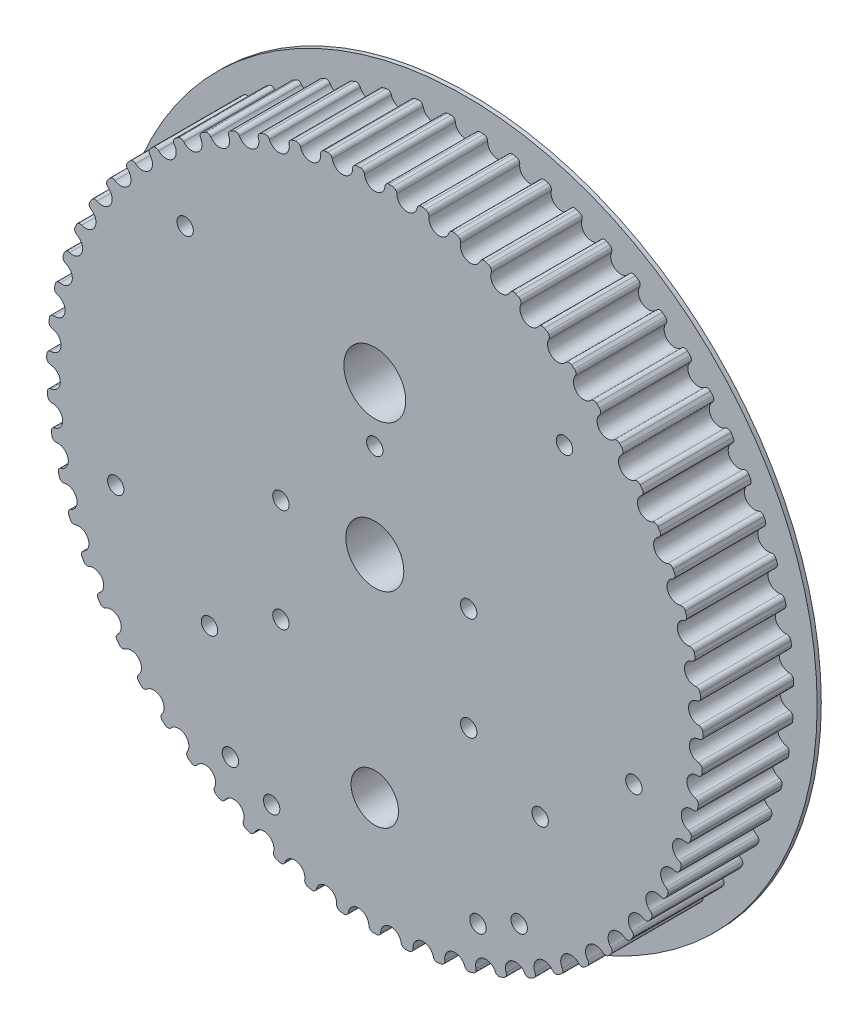
from build123d import *

# Parameters (mm, degrees)
BOSS_EXTRUDE1_DEPTH = 22
SKETCH2_R           = 85.214091318
BOSS_EXTRUDE2_DEPTH = 1
SKETCH3_R           = 7.025
SKETCH3_R_2         = 5.75
SKETCH3_R_3         = 7.5
CUT_EXTRUDE1_DEPTH  = 123.686114611
SKETCH4_R           = 1.985
CUT_EXTRUDE2_DEPTH  = 18


with BuildPart() as part:
    # Sketch1 → Boss-Extrude1 (new body)
    with BuildSketch(Plane.XY):
        with BuildLine():
            ThreePointArc((2.481562541, 78.535189471), (0, 76.25), (-2.481562541, 78.535189471))
            ThreePointArc((-2.481562541, 78.535189471), (-2.817232799, 79.203373934), (-3.522465026, 79.451954917))
            ThreePointArc((-3.522465026, 79.451954917), (-3.743368627, 79.441853524), (-3.964243287, 79.431137945))
            ThreePointArc((-3.964243287, 79.431137945), (-4.185087298, 79.419808262), (-4.405898952, 79.407864563))
            ThreePointArc((-4.405898952, 79.407864563), (-5.082876049, 79.09030038), (-5.350348598, 78.392014311))
            ThreePointArc((-5.350348598, 78.392014311), (-7.592048303, 75.871096622), (-10.288810797, 77.897846634))
            ThreePointArc((-10.288810797, 77.897846634), (-10.689342722, 78.529288774), (-11.415821165, 78.706416048))
            ThreePointArc((-11.415821165, 78.706416048), (-11.634621272, 78.674369955), (-11.853331429, 78.64171561))
            ThreePointArc((-11.853331429, 78.64171561), (-12.071949944, 78.608453264), (-12.290475128, 78.574583175))
            ThreePointArc((-12.290475128, 78.574583175), (-12.932468992, 78.191191889), (-13.129085569, 77.469744094))
            ThreePointArc((-13.129085569, 77.469744094), (-15.108643419, 74.738152198), (-17.993804229, 76.48632))
            ThreePointArc((-17.993804229, 76.48632), (-18.455217155, 77.074744261), (-19.195721745, 77.178657456))
            ThreePointArc((-19.195721745, 77.178657456), (-19.410243824, 77.124985152), (-19.624615838, 77.070716574))
            ThreePointArc((-19.624615838, 77.070716574), (-19.838836129, 77.015852141), (-20.05290304, 76.960392278))
            ThreePointArc((-20.05290304, 76.960392278), (-20.653533247, 76.514984203), (-20.777339789, 75.777544755))
            ThreePointArc((-20.777339789, 75.777544755), (-22.475082049, 72.862426441), (-25.51996715, 74.314637956))
            ThreePointArc((-25.51996715, 74.314637956), (-26.037675348, 74.854196313), (-26.784846617, 74.883862692))
            ThreePointArc((-26.784846617, 74.883862692), (-26.992958653, 74.809097596), (-27.200861999, 74.733754131))
            ThreePointArc((-27.200861999, 74.733754131), (-27.408555047, 74.657832879), (-27.616036193, 74.581334428))
            ThreePointArc((-27.616036193, 74.581334428), (-28.169333411, 74.078336229), (-28.219099472, 73.332234132))
            ThreePointArc((-28.219099472, 73.332234132), (-29.618153216, 70.262561155), (-32.792501173, 71.404383652))
            ThreePointArc((-32.792501173, 71.404383652), (-33.361359426, 71.889713732), (-34.107771651, 71.844838458))
            ThreePointArc((-34.107771651, 71.844838458), (-34.307405331, 71.749723619), (-34.506773772, 71.654054064))
            ThreePointArc((-34.506773772, 71.654054064), (-34.705875432, 71.557830533), (-34.904708771, 71.461053768))
            ThreePointArc((-34.904708771, 71.461053768), (-35.405174083, 70.905464468), (-35.380405067, 70.15811482))
            ThreePointArc((-35.380405067, 70.15811482), (-36.46686587, 66.964394969), (-39.739128586, 67.784480503))
            ThreePointArc((-39.739128586, 67.784480503), (-40.353483326, 68.210758878), (-41.091718326, 68.091787941))
            ThreePointArc((-41.091718326, 68.091787941), (-41.280889602, 67.977268654), (-41.469741725, 67.862223816))
            ThreePointArc((-41.469741725, 67.862223816), (-41.658273234, 67.746654317), (-41.846482671, 67.630561051))
            ThreePointArc((-41.846482671, 67.630561051), (-42.289142228, 67.027902345), (-42.1900843, 66.286732644))
            ThreePointArc((-42.1900843, 66.286732644), (-42.953154427, 63.000706542), (-46.290810685, 63.490904734))
            ThreePointArc((-46.290810685, 63.490904734), (-46.944556178, 63.853894857), (-47.667277043, 63.662010644))
            ThreePointArc((-47.667277043, 63.662010644), (-47.844105846, 63.529225053), (-48.020564753, 63.395948299))
            ThreePointArc((-48.020564753, 63.395948299), (-48.1966524, 63.262181415), (-48.372367426, 63.127925434))
            ThreePointArc((-48.372367426, 63.127925434), (-48.752821879, 62.484186815), (-48.580459521, 61.756563138))
            ThreePointArc((-48.580459521, 61.756563138), (-49.012555239, 58.410888788), (-52.382433911, 58.566327829))
            ThreePointArc((-52.382433911, 58.566327829), (-53.069072941, 58.862422142), (-53.769096946, 58.599531685))
            ThreePointArc((-53.769096946, 58.599531685), (-53.931825871, 58.449799471), (-54.094137835, 58.299615367))
            ThreePointArc((-54.094137835, 58.299615367), (-54.256031583, 58.148980532), (-54.417505862, 57.997896132))
            ThreePointArc((-54.417505862, 57.997896132), (-54.731974083, 57.319475365), (-54.488020309, 56.612629161))
            ThreePointArc((-54.488020309, 56.612629161), (-54.584847256, 53.240557379), (-57.953456975, 53.059692446))
            ThreePointArc((-57.953456975, 53.059692446), (-58.666165415, 53.28594823), (-59.336535406, 52.954664252))
            ThreePointArc((-59.336535406, 52.954664252), (-59.483547181, 52.789473523), (-59.630099072, 52.623874664))
            ThreePointArc((-59.630099072, 52.623874664), (-59.776189947, 52.457868956), (-59.921818676, 52.291457682))
            ThreePointArc((-59.921818676, 52.291457682), (-60.16717534, 51.585097217), (-59.854054672, 50.906053443))
            ThreePointArc((-59.854054672, 50.906053443), (-59.614650538, 47.541097392), (-62.948512547, 47.025726001))
            ThreePointArc((-62.948512547, 47.025726001), (-63.680207179, 47.179894625), (-64.314260719, 46.783509575))
            ThreePointArc((-64.314260719, 46.783509575), (-64.444094274, 46.60450207), (-64.573429595, 46.425134253))
            ThreePointArc((-64.573429595, 46.425134253), (-64.70226568, 46.245407511), (-64.830601536, 46.065323233))
            ThreePointArc((-64.830601536, 46.065323233), (-65.004408176, 45.338043196), (-64.625232549, 44.693550494))
            ThreePointArc((-64.625232549, 44.693550494), (-64.05197664, 41.36915262), (-67.31795752, 40.524396765))
            ThreePointArc((-67.31795752, 40.524396765), (-68.061366435, 40.604946031), (-68.652802015, 40.147399361))
            ThreePointArc((-68.652802015, 40.147399361), (-68.764167006, 39.956354137), (-68.875000363, 39.765))
            ThreePointArc((-68.875000363, 39.765), (-68.985301229, 39.573338429), (-69.09506875, 39.381370905))
            ThreePointArc((-69.09506875, 39.381370905), (-69.195598, 38.640399334), (-68.754135831, 38.036862961))
            ThreePointArc((-68.754135831, 38.036862961), (-67.852725422, 34.786062623), (-71.018366388, 33.620317866))
            ThreePointArc((-71.018366388, 33.620317866), (-71.766101254, 33.62644724), (-72.309040921, 33.112286256))
            ThreePointArc((-72.309040921, 33.112286256), (-72.400830553, 32.911102006), (-72.492060434, 32.709663312))
            ThreePointArc((-72.492060434, 32.709663312), (-72.58272986, 32.50797173), (-72.67283813, 32.306028821))
            ThreePointArc((-72.67283813, 32.306028821), (-72.699090883, 31.558729823), (-72.199729622, 31.002147995))
            ThreePointArc((-72.199729622, 31.002147995), (-70.979123334, 27.857253108), (-74.012962824, 26.382105145))
            ThreePointArc((-74.012962824, 26.382105145), (-74.757592316, 26.31375371), (-75.246640092, 25.748088374))
            ThreePointArc((-75.246640092, 25.748088374), (-75.317942118, 25.538764558), (-75.388661841, 25.329243295))
            ThreePointArc((-75.388661841, 25.329243295), (-75.458798713, 25.119526204), (-75.528352194, 24.909614908))
            ThreePointArc((-75.528352194, 24.909614908), (-75.480067539, 24.163415477), (-74.927770063, 23.659319755))
            ThreePointArc((-74.927770063, 23.659319755), (-73.40009883, 20.651585696), (-76.271985184, 18.881695209))
            ThreePointArc((-76.271985184, 18.881695209), (-77.006108839, 18.739542273), (-77.436404347, 18.127994421))
            ThreePointArc((-77.436404347, 18.127994421), (-77.486510136, 17.912611393), (-77.536016856, 17.697089878))
            ThreePointArc((-77.536016856, 17.697089878), (-77.584924124, 17.481431541), (-77.633231562, 17.265638051))
            ThreePointArc((-77.633231562, 17.265638051), (-77.510889373, 16.527954251), (-76.911144662, 16.081354565))
            ThreePointArc((-76.911144662, 16.081354565), (-75.091591167, 13.240673547), (-77.772982288, 11.193630504))
            ThreePointArc((-77.772982288, 11.193630504), (-78.489304057, 10.979088846), (-78.856570827, 10.327736316))
            ThreePointArc((-78.856570827, 10.327736316), (-78.884982404, 10.108434649), (-78.912784101, 9.889054831))
            ThreePointArc((-78.912784101, 9.889054831), (-78.939975701, 9.669598558), (-78.966556996, 9.450067526))
            ThreePointArc((-78.966556996, 9.450067526), (-78.771373166, 8.728230791), (-78.130141751, 8.343565648))
            ThreePointArc((-78.130141751, 8.343565648), (-76.036789535, 5.698169636), (-78.501036553, 3.39431847))
            ThreePointArc((-78.501036553, 3.39431847), (-79.192437307, 3.109520302), (-79.493025278, 2.424836527))
            ThreePointArc((-79.493025278, 2.424836527), (-79.499460277, 2.203795739), (-79.505280645, 1.982737914))
            ThreePointArc((-79.505280645, 1.982737914), (-79.510486335, 1.761664759), (-79.515077309, 1.540577985))
            ThreePointArc((-79.515077309, 1.540577985), (-79.248991662, 0.841762252), (-78.572646391, 0.522854628))
            ThreePointArc((-78.572646391, 0.522854628), (-76.226300128, -1.900965245), (-78.448912249, -4.438727826))
            ThreePointArc((-78.448912249, -4.438727826), (-79.108520537, -4.790952053), (-79.33944233, -5.502162377))
            ThreePointArc((-79.33944233, -5.502162377), (-79.323836797, -5.722745482), (-79.30761799, -5.943284343))
            ThreePointArc((-79.30761799, -5.943284343), (-79.290786034, -6.163777255), (-79.273341061, -6.384222513))
            ThreePointArc((-79.273341061, -6.384222513), (-78.938998076, -7.053072098), (-78.23426077, -7.303052757))
            ThreePointArc((-78.23426077, -7.303052757), (-75.658239503, -9.481207479), (-77.617127411, -12.227660051))
            ThreePointArc((-77.617127411, -12.227660051), (-78.238387749, -12.643809773), (-78.397348359, -13.374478319))
            ThreePointArc((-78.397348359, -13.374478319), (-78.359857389, -13.592411488), (-78.321760597, -13.81023957))
            ThreePointArc((-78.321760597, -13.81023957), (-78.283058279, -14.027960881), (-78.243750734, -14.245573739))
            ThreePointArc((-78.243750734, -14.245573739), (-77.844473261, -14.877809849), (-77.118347918, -15.056379122))
            ThreePointArc((-77.118347918, -15.056379122), (-74.338253304, -16.967221214), (-76.013948689, -19.895068297))
            ThreePointArc((-76.013948689, -19.895068297), (-76.590686714, -20.371007631), (-76.676106319, -21.113872687))
            ThreePointArc((-76.676106319, -21.113872687), (-76.617102513, -21.326990001), (-76.55750636, -21.539942431))
            ThreePointArc((-76.55750636, -21.539942431), (-76.49731832, -21.75272833), (-76.436538859, -21.965346053))
            ThreePointArc((-76.436538859, -21.965346053), (-75.976295098, -22.554685242), (-75.235998277, -22.660068427))
            ThreePointArc((-75.235998277, -22.660068427), (-72.279460145, -24.284607082), (-73.655309194, -27.364750416))
            ThreePointArc((-73.655309194, -27.364750416), (-74.181793024, -27.895749264), (-74.192822685, -28.643427902))
            ThreePointArc((-74.192822685, -28.643427902), (-74.112892451, -28.849611307), (-74.03238923, -29.055571668))
            ThreePointArc((-74.03238923, -29.055571668), (-73.951313644, -29.261307392), (-73.869666321, -29.46681689))
            ThreePointArc((-73.869666321, -29.46681689), (-73.353030381, -30.00740204), (-72.605919484, -30.038551792))
            ThreePointArc((-72.605919484, -30.038551792), (-69.502321239, -31.360641614), (-70.564650146, -34.562469351))
            ThreePointArc((-70.564650146, -34.562469351), (-71.035647347, -35.143250407), (-70.972177448, -35.888311862))
            ThreePointArc((-70.972177448, -35.888311862), (-70.872115167, -36.085512214), (-70.771504955, -36.282433579))
            ThreePointArc((-70.771504955, -36.282433579), (-70.670347589, -36.479074435), (-70.568643852, -36.675433262))
            ThreePointArc((-70.568643852, -36.675433262), (-70.000750292, -37.161891795), (-69.254250443, -37.118498533))
            ThreePointArc((-69.254250443, -37.118498533), (-66.034437039, -38.125), (-66.772687902, -41.416690937))
            ThreePointArc((-66.772687902, -41.416690937), (-67.183517493, -42.04148214), (-67.046178825, -42.776521655))
            ThreePointArc((-67.046178825, -42.776521655), (-66.926978962, -42.962779089), (-66.807261668, -43.148704365))
            ThreePointArc((-66.807261668, -43.148704365), (-66.687027869, -43.334296048), (-66.566278495, -43.519552701))
            ThreePointArc((-66.566278495, -43.519552701), (-65.952771298, -43.947049973), (-65.214301548, -43.82954496))
            ThreePointArc((-65.214301548, -43.82954496), (-61.910272936, -44.510455008), (-62.317108686, -47.859294842))
            ThreePointArc((-62.317108686, -47.859294842), (-62.663687658, -48.521886734), (-62.453845156, -49.239599158))
            ThreePointArc((-62.453845156, -49.239599158), (-62.316692372, -49.413062563), (-62.179057801, -49.586143942))
            ThreePointArc((-62.179057801, -49.586143942), (-62.040942507, -49.758841957), (-61.902347557, -49.931155273))
            ThreePointArc((-61.902347557, -49.931155273), (-61.249324032, -50.295442625), (-60.526223625, -50.104993678))
            ThreePointArc((-60.526223625, -50.104993678), (-57.170816726, -50.453545117), (-57.242194048, -53.826251573))
            ThreePointArc((-57.242194048, -53.826251573), (-57.521077943, -54.520059019), (-57.240817114, -55.213311403))
            ThreePointArc((-57.240817114, -55.213311403), (-57.087074496, -55.372256822), (-56.932890522, -55.530774142))
            ThreePointArc((-56.932890522, -55.530774142), (-56.778266384, -55.68886214), (-56.623203278, -55.846519592))
            ThreePointArc((-56.623203278, -55.846519592), (-55.937153466, -56.143976572), (-55.2366089, -55.882476458))
            ThreePointArc((-55.2366089, -55.882476458), (-51.863171255, -55.895205227), (-51.598380767, -59.258258834))
            ThreePointArc((-51.598380767, -59.258258834), (-51.806797913, -59.976386464), (-51.458904116, -60.638288953))
            ThreePointArc((-51.458904116, -60.638288953), (-51.290099626, -60.781136715), (-51.120898598, -60.923514561))
            ThreePointArc((-51.120898598, -60.923514561), (-50.951302341, -61.065421392), (-50.781312166, -61.206856109))
            ThreePointArc((-50.781312166, -61.206856109), (-50.069054339, -61.434526456), (-49.398027939, -61.104574081))
            ThreePointArc((-49.398027939, -61.104574081), (-46.040086287, -60.781353676), (-45.441759598, -64.101330895))
            ThreePointArc((-45.441759598, -64.101330895), (-45.577638649, -64.836641634), (-45.16556941, -65.460615945))
            ThreePointArc((-45.16556941, -65.460615945), (-44.983380703, -65.585946364), (-44.800844218, -65.710769721))
            ThreePointArc((-44.800844218, -65.710769721), (-44.617961365, -65.835085051), (-44.434733559, -65.958891391))
            ThreePointArc((-44.434733559, -65.958891391), (-43.703346455, -66.114512415), (-43.068507183, -65.719386994))
            ThreePointArc((-43.068507183, -65.719386994), (-39.759434258, -65.063429724), (-38.833517805, -68.307335131))
            ThreePointArc((-38.833517805, -68.307335131), (-38.895508337, -69.05252113), (-38.423358983, -69.632365926))
            ThreePointArc((-38.423358983, -69.632365926), (-38.229596733, -69.738933413), (-38.03553892, -69.84496173))
            ThreePointArc((-38.03553892, -69.84496173), (-37.841187043, -69.950450057), (-37.646542607, -70.055397578))
            ThreePointArc((-37.646542607, -70.055397578), (-36.903295079, -70.137422647), (-36.310952253, -69.681051113))
            ThreePointArc((-36.310952253, -69.681051113), (-33.083635108, -68.698876178), (-31.839331066, -71.834470382))
            ThreePointArc((-31.839331066, -71.834470382), (-31.826816988, -72.582125648), (-31.299279953, -73.112078171))
            ThreePointArc((-31.299279953, -73.112078171), (-31.095869855, -73.19882361), (-30.892219348, -73.28500313))
            ThreePointArc((-30.892219348, -73.28500313), (-30.688330004, -73.370616064), (-30.484203401, -73.455661749))
            ThreePointArc((-30.484203401, -73.455661749), (-29.736482177, -73.463275662), (-29.192522767, -72.950193641))
            ThreePointArc((-29.192522767, -72.950193641), (-26.079035929, -71.651562335), (-24.528710751, -74.647682394))
            ThreePointArc((-24.528710751, -74.647682394), (-24.441816432, -75.390376393), (-23.864134616, -75.865169736))
            ThreePointArc((-23.864134616, -75.865169736), (-23.653098253, -75.931231012), (-23.441879021, -75.996705244))
            ThreePointArc((-23.441879021, -75.996705244), (-23.230478554, -76.061591925), (-23.018898485, -76.125890553))
            ThreePointArc((-23.018898485, -76.125890553), (-22.274134756, -76.059017638), (-21.783964874, -75.494324371))
            ThreePointArc((-21.783964874, -75.494324371), (-18.815251574, -73.892143075), (-16.974313088, -76.719012201))
            ThreePointArc((-16.974313088, -76.719012201), (-16.813902125, -77.449363707), (-16.191816788, -77.86427916))
            ThreePointArc((-16.191816788, -77.86427916), (-15.975251533, -77.908999727), (-15.758562769, -77.953117959))
            ThreePointArc((-15.758562769, -77.953117959), (-15.541752171, -77.996633514), (-15.324821415, -78.039546056))
            ThreePointArc((-15.324821415, -78.039546056), (-14.590416976, -77.898850926), (-14.158908151, -77.288158587))
            ThreePointArc((-14.158908151, -77.288158587), (-11.364472796, -75.3983505), (-9.251217075, -78.027873997))
            ThreePointArc((-9.251217075, -78.027873997), (-9.018883703, -78.738624448), (-8.358577411, -79.089538396))
            ThreePointArc((-8.358577411, -79.089538396), (-8.138635586, -79.1124738), (-7.91863084, -79.134797565))
            ThreePointArc((-7.91863084, -79.134797565), (-7.698564872, -79.156509517), (-7.478439385, -79.177609489))
            ThreePointArc((-7.478439385, -79.177609489), (-6.761693078, -78.964490437), (-6.393133838, -78.31386836))
            ThreePointArc((-6.393133838, -78.31386836), (-3.800748782, -76.155215243), (-1.436178311, -78.561259726))
            ThreePointArc((-1.436178311, -78.561259726), (-1.134231564, -79.245345365), (-0.442266735, -79.528770267))
            ThreePointArc((-0.442266735, -79.528770267), (-0.221134223, -79.529692566), (0, -79.53))
            ThreePointArc((0, -79.53), (0.221134223, -79.529692566), (0.442266735, -79.528770267))
            ThreePointArc((0.442266735, -79.528770267), (1.134231564, -79.245345365), (1.436178311, -78.561259726))
            ThreePointArc((1.436178311, -78.561259726), (3.800748782, -76.155215243), (6.393133838, -78.31386836))
            ThreePointArc((6.393133838, -78.31386836), (6.761693078, -78.964490437), (7.478439385, -79.177609489))
            ThreePointArc((7.478439385, -79.177609489), (7.698564872, -79.156509517), (7.91863084, -79.134797565))
            ThreePointArc((7.91863084, -79.134797565), (8.138635586, -79.1124738), (8.358577411, -79.089538396))
            ThreePointArc((8.358577411, -79.089538396), (9.018883703, -78.738624448), (9.251217075, -78.027873997))
            ThreePointArc((9.251217075, -78.027873997), (11.364472796, -75.3983505), (14.158908151, -77.288158587))
            ThreePointArc((14.158908151, -77.288158587), (14.590416976, -77.898850926), (15.324821415, -78.039546056))
            ThreePointArc((15.324821415, -78.039546056), (15.541752171, -77.996633514), (15.758562769, -77.953117959))
            ThreePointArc((15.758562769, -77.953117959), (15.975251533, -77.908999727), (16.191816788, -77.86427916))
            ThreePointArc((16.191816788, -77.86427916), (16.813902125, -77.449363707), (16.974313088, -76.719012201))
            ThreePointArc((16.974313088, -76.719012201), (18.815251574, -73.892143075), (21.783964874, -75.494324371))
            ThreePointArc((21.783964874, -75.494324371), (22.274134756, -76.059017638), (23.018898485, -76.125890553))
            ThreePointArc((23.018898485, -76.125890553), (23.230478554, -76.061591925), (23.441879021, -75.996705244))
            ThreePointArc((23.441879021, -75.996705244), (23.653098253, -75.931231012), (23.864134616, -75.865169736))
            ThreePointArc((23.864134616, -75.865169736), (24.441816432, -75.390376393), (24.528710751, -74.647682394))
            ThreePointArc((24.528710751, -74.647682394), (26.079035929, -71.651562335), (29.192522767, -72.950193641))
            ThreePointArc((29.192522767, -72.950193641), (29.736482177, -73.463275662), (30.484203401, -73.455661749))
            ThreePointArc((30.484203401, -73.455661749), (30.688330004, -73.370616064), (30.892219348, -73.28500313))
            ThreePointArc((30.892219348, -73.28500313), (31.095869855, -73.19882361), (31.299279953, -73.112078171))
            ThreePointArc((31.299279953, -73.112078171), (31.826816988, -72.582125648), (31.839331066, -71.834470382))
            ThreePointArc((31.839331066, -71.834470382), (33.083635108, -68.698876178), (36.310952253, -69.681051113))
            ThreePointArc((36.310952253, -69.681051113), (36.903295079, -70.137422647), (37.646542607, -70.055397578))
            ThreePointArc((37.646542607, -70.055397578), (37.841187043, -69.950450057), (38.03553892, -69.84496173))
            ThreePointArc((38.03553892, -69.84496173), (38.229596733, -69.738933413), (38.423358983, -69.632365926))
            ThreePointArc((38.423358983, -69.632365926), (38.895508337, -69.05252113), (38.833517805, -68.307335131))
            ThreePointArc((38.833517805, -68.307335131), (39.759434258, -65.063429724), (43.068507183, -65.719386994))
            ThreePointArc((43.068507183, -65.719386994), (43.703346455, -66.114512415), (44.434733559, -65.958891391))
            ThreePointArc((44.434733559, -65.958891391), (44.617961365, -65.835085051), (44.800844218, -65.710769721))
            ThreePointArc((44.800844218, -65.710769721), (44.983380703, -65.585946364), (45.16556941, -65.460615945))
            ThreePointArc((45.16556941, -65.460615945), (45.577638649, -64.836641634), (45.441759598, -64.101330895))
            ThreePointArc((45.441759598, -64.101330895), (46.040086287, -60.781353676), (49.398027939, -61.104574081))
            ThreePointArc((49.398027939, -61.104574081), (50.069054339, -61.434526456), (50.781312166, -61.206856109))
            ThreePointArc((50.781312166, -61.206856109), (50.951302341, -61.065421392), (51.120898598, -60.923514561))
            ThreePointArc((51.120898598, -60.923514561), (51.290099626, -60.781136715), (51.458904116, -60.638288953))
            ThreePointArc((51.458904116, -60.638288953), (51.806797913, -59.976386464), (51.598380767, -59.258258834))
            ThreePointArc((51.598380767, -59.258258834), (51.863171255, -55.895205227), (55.2366089, -55.882476458))
            ThreePointArc((55.2366089, -55.882476458), (55.937153466, -56.143976572), (56.623203278, -55.846519592))
            ThreePointArc((56.623203278, -55.846519592), (56.778266384, -55.68886214), (56.932890522, -55.530774142))
            ThreePointArc((56.932890522, -55.530774142), (57.087074496, -55.372256822), (57.240817114, -55.213311403))
            ThreePointArc((57.240817114, -55.213311403), (57.521077943, -54.520059019), (57.242194048, -53.826251573))
            ThreePointArc((57.242194048, -53.826251573), (57.170816726, -50.453545117), (60.526223625, -50.104993678))
            ThreePointArc((60.526223625, -50.104993678), (61.249324032, -50.295442625), (61.902347557, -49.931155273))
            ThreePointArc((61.902347557, -49.931155273), (62.040942507, -49.758841957), (62.179057801, -49.586143942))
            ThreePointArc((62.179057801, -49.586143942), (62.316692372, -49.413062563), (62.453845156, -49.239599158))
            ThreePointArc((62.453845156, -49.239599158), (62.663687658, -48.521886734), (62.317108686, -47.859294842))
            ThreePointArc((62.317108686, -47.859294842), (61.910272936, -44.510455008), (65.214301548, -43.82954496))
            ThreePointArc((65.214301548, -43.82954496), (65.952771298, -43.947049973), (66.566278495, -43.519552701))
            ThreePointArc((66.566278495, -43.519552701), (66.687027869, -43.334296048), (66.807261668, -43.148704365))
            ThreePointArc((66.807261668, -43.148704365), (66.926978962, -42.962779089), (67.046178825, -42.776521655))
            ThreePointArc((67.046178825, -42.776521655), (67.183517493, -42.04148214), (66.772687902, -41.416690937))
            ThreePointArc((66.772687902, -41.416690937), (66.034437039, -38.125), (69.254250443, -37.118498533))
            ThreePointArc((69.254250443, -37.118498533), (70.000750292, -37.161891795), (70.568643852, -36.675433262))
            ThreePointArc((70.568643852, -36.675433262), (70.670347589, -36.479074435), (70.771504955, -36.282433579))
            ThreePointArc((70.771504955, -36.282433579), (70.872115167, -36.085512214), (70.972177448, -35.888311862))
            ThreePointArc((70.972177448, -35.888311862), (71.035647347, -35.143250407), (70.564650146, -34.562469351))
            ThreePointArc((70.564650146, -34.562469351), (69.502321239, -31.360641614), (72.605919484, -30.038551792))
            ThreePointArc((72.605919484, -30.038551792), (73.353030381, -30.00740204), (73.869666321, -29.46681689))
            ThreePointArc((73.869666321, -29.46681689), (73.951313644, -29.261307392), (74.03238923, -29.055571668))
            ThreePointArc((74.03238923, -29.055571668), (74.112892451, -28.849611307), (74.192822685, -28.643427902))
            ThreePointArc((74.192822685, -28.643427902), (74.181793024, -27.895749264), (73.655309194, -27.364750416))
            ThreePointArc((73.655309194, -27.364750416), (72.279460145, -24.284607082), (75.235998277, -22.660068427))
            ThreePointArc((75.235998277, -22.660068427), (75.976295098, -22.554685242), (76.436538859, -21.965346053))
            ThreePointArc((76.436538859, -21.965346053), (76.49731832, -21.75272833), (76.55750636, -21.539942431))
            ThreePointArc((76.55750636, -21.539942431), (76.617102513, -21.326990001), (76.676106319, -21.113872687))
            ThreePointArc((76.676106319, -21.113872687), (76.590686714, -20.371007631), (76.013948689, -19.895068297))
            ThreePointArc((76.013948689, -19.895068297), (74.338253304, -16.967221214), (77.118347918, -15.056379122))
            ThreePointArc((77.118347918, -15.056379122), (77.844473261, -14.877809849), (78.243750734, -14.245573739))
            ThreePointArc((78.243750734, -14.245573739), (78.283058279, -14.027960881), (78.321760597, -13.81023957))
            ThreePointArc((78.321760597, -13.81023957), (78.359857389, -13.592411488), (78.397348359, -13.374478319))
            ThreePointArc((78.397348359, -13.374478319), (78.238387749, -12.643809773), (77.617127411, -12.227660051))
            ThreePointArc((77.617127411, -12.227660051), (75.658239503, -9.481207479), (78.23426077, -7.303052757))
            ThreePointArc((78.23426077, -7.303052757), (78.938998076, -7.053072098), (79.273341061, -6.384222513))
            ThreePointArc((79.273341061, -6.384222513), (79.290786034, -6.163777255), (79.30761799, -5.943284343))
            ThreePointArc((79.30761799, -5.943284343), (79.323836797, -5.722745482), (79.33944233, -5.502162377))
            ThreePointArc((79.33944233, -5.502162377), (79.108520537, -4.790952053), (78.448912249, -4.438727826))
            ThreePointArc((78.448912249, -4.438727826), (76.226300128, -1.900965245), (78.572646391, 0.522854628))
            ThreePointArc((78.572646391, 0.522854628), (79.248991662, 0.841762252), (79.515077309, 1.540577985))
            ThreePointArc((79.515077309, 1.540577985), (79.510486335, 1.761664759), (79.505280645, 1.982737914))
            ThreePointArc((79.505280645, 1.982737914), (79.499460277, 2.203795739), (79.493025278, 2.424836527))
            ThreePointArc((79.493025278, 2.424836527), (79.192437307, 3.109520302), (78.501036553, 3.39431847))
            ThreePointArc((78.501036553, 3.39431847), (76.036789535, 5.698169636), (78.130141751, 8.343565648))
            ThreePointArc((78.130141751, 8.343565648), (78.771373166, 8.728230791), (78.966556996, 9.450067526))
            ThreePointArc((78.966556996, 9.450067526), (78.939975701, 9.669598558), (78.912784101, 9.889054831))
            ThreePointArc((78.912784101, 9.889054831), (78.884982404, 10.108434649), (78.856570827, 10.327736316))
            ThreePointArc((78.856570827, 10.327736316), (78.489304057, 10.979088846), (77.772982288, 11.193630504))
            ThreePointArc((77.772982288, 11.193630504), (75.091591167, 13.240673547), (76.911144662, 16.081354565))
            ThreePointArc((76.911144662, 16.081354565), (77.510889373, 16.527954251), (77.633231562, 17.265638051))
            ThreePointArc((77.633231562, 17.265638051), (77.584924124, 17.481431541), (77.536016856, 17.697089878))
            ThreePointArc((77.536016856, 17.697089878), (77.486510136, 17.912611393), (77.436404347, 18.127994421))
            ThreePointArc((77.436404347, 18.127994421), (77.006108839, 18.739542273), (76.271985184, 18.881695209))
            ThreePointArc((76.271985184, 18.881695209), (73.40009883, 20.651585696), (74.927770063, 23.659319755))
            ThreePointArc((74.927770063, 23.659319755), (75.480067539, 24.163415477), (75.528352194, 24.909614908))
            ThreePointArc((75.528352194, 24.909614908), (75.458798713, 25.119526204), (75.388661841, 25.329243295))
            ThreePointArc((75.388661841, 25.329243295), (75.317942118, 25.538764558), (75.246640092, 25.748088374))
            ThreePointArc((75.246640092, 25.748088374), (74.757592316, 26.31375371), (74.012962824, 26.382105145))
            ThreePointArc((74.012962824, 26.382105145), (70.979123334, 27.857253108), (72.199729622, 31.002147995))
            ThreePointArc((72.199729622, 31.002147995), (72.699090883, 31.558729823), (72.67283813, 32.306028821))
            ThreePointArc((72.67283813, 32.306028821), (72.58272986, 32.50797173), (72.492060434, 32.709663312))
            ThreePointArc((72.492060434, 32.709663312), (72.400830553, 32.911102006), (72.309040921, 33.112286256))
            ThreePointArc((72.309040921, 33.112286256), (71.766101254, 33.62644724), (71.018366388, 33.620317866))
            ThreePointArc((71.018366388, 33.620317866), (67.852725422, 34.786062623), (68.754135831, 38.036862961))
            ThreePointArc((68.754135831, 38.036862961), (69.195598, 38.640399334), (69.09506875, 39.381370905))
            ThreePointArc((69.09506875, 39.381370905), (68.985301229, 39.573338429), (68.875000363, 39.765))
            ThreePointArc((68.875000363, 39.765), (68.764167006, 39.956354137), (68.652802015, 40.147399361))
            ThreePointArc((68.652802015, 40.147399361), (68.061366435, 40.604946031), (67.31795752, 40.524396765))
            ThreePointArc((67.31795752, 40.524396765), (64.05197664, 41.36915262), (64.625232549, 44.693550494))
            ThreePointArc((64.625232549, 44.693550494), (65.004408176, 45.338043196), (64.830601536, 46.065323233))
            ThreePointArc((64.830601536, 46.065323233), (64.70226568, 46.245407511), (64.573429595, 46.425134253))
            ThreePointArc((64.573429595, 46.425134253), (64.444094274, 46.60450207), (64.314260719, 46.783509575))
            ThreePointArc((64.314260719, 46.783509575), (63.680207179, 47.179894625), (62.948512547, 47.025726001))
            ThreePointArc((62.948512547, 47.025726001), (59.614650538, 47.541097392), (59.854054672, 50.906053443))
            ThreePointArc((59.854054672, 50.906053443), (60.16717534, 51.585097217), (59.921818676, 52.291457682))
            ThreePointArc((59.921818676, 52.291457682), (59.776189947, 52.457868956), (59.630099072, 52.623874664))
            ThreePointArc((59.630099072, 52.623874664), (59.483547181, 52.789473523), (59.336535406, 52.954664252))
            ThreePointArc((59.336535406, 52.954664252), (58.666165415, 53.28594823), (57.953456975, 53.059692446))
            ThreePointArc((57.953456975, 53.059692446), (54.584847256, 53.240557379), (54.488020309, 56.612629161))
            ThreePointArc((54.488020309, 56.612629161), (54.731974083, 57.319475365), (54.417505862, 57.997896132))
            ThreePointArc((54.417505862, 57.997896132), (54.256031583, 58.148980532), (54.094137835, 58.299615367))
            ThreePointArc((54.094137835, 58.299615367), (53.931825871, 58.449799471), (53.769096946, 58.599531685))
            ThreePointArc((53.769096946, 58.599531685), (53.069072941, 58.862422142), (52.382433911, 58.566327829))
            ThreePointArc((52.382433911, 58.566327829), (49.012555239, 58.410888788), (48.580459521, 61.756563138))
            ThreePointArc((48.580459521, 61.756563138), (48.752821879, 62.484186815), (48.372367426, 63.127925434))
            ThreePointArc((48.372367426, 63.127925434), (48.1966524, 63.262181415), (48.020564753, 63.395948299))
            ThreePointArc((48.020564753, 63.395948299), (47.844105846, 63.529225053), (47.667277043, 63.662010644))
            ThreePointArc((47.667277043, 63.662010644), (46.944556178, 63.853894857), (46.290810685, 63.490904734))
            ThreePointArc((46.290810685, 63.490904734), (42.953154427, 63.000706542), (42.1900843, 66.286732644))
            ThreePointArc((42.1900843, 66.286732644), (42.289142228, 67.027902345), (41.846482671, 67.630561051))
            ThreePointArc((41.846482671, 67.630561051), (41.658273234, 67.746654317), (41.469741725, 67.862223816))
            ThreePointArc((41.469741725, 67.862223816), (41.280889602, 67.977268654), (41.091718326, 68.091787941))
            ThreePointArc((41.091718326, 68.091787941), (40.353483326, 68.210758878), (39.739128586, 67.784480503))
            ThreePointArc((39.739128586, 67.784480503), (36.46686587, 66.964394969), (35.380405067, 70.15811482))
            ThreePointArc((35.380405067, 70.15811482), (35.405174083, 70.905464468), (34.904708771, 71.461053768))
            ThreePointArc((34.904708771, 71.461053768), (34.705875432, 71.557830533), (34.506773772, 71.654054064))
            ThreePointArc((34.506773772, 71.654054064), (34.307405331, 71.749723619), (34.107771651, 71.844838458))
            ThreePointArc((34.107771651, 71.844838458), (33.361359426, 71.889713732), (32.792501173, 71.404383652))
            ThreePointArc((32.792501173, 71.404383652), (29.618153216, 70.262561155), (28.219099472, 73.332234132))
            ThreePointArc((28.219099472, 73.332234132), (28.169333411, 74.078336229), (27.616036193, 74.581334428))
            ThreePointArc((27.616036193, 74.581334428), (27.408555047, 74.657832879), (27.200861999, 74.733754131))
            ThreePointArc((27.200861999, 74.733754131), (26.992958653, 74.809097596), (26.784846617, 74.883862692))
            ThreePointArc((26.784846617, 74.883862692), (26.037675348, 74.854196313), (25.51996715, 74.314637956))
            ThreePointArc((25.51996715, 74.314637956), (22.475082049, 72.862426441), (20.777339789, 75.777544755))
            ThreePointArc((20.777339789, 75.777544755), (20.653533247, 76.514984203), (20.05290304, 76.960392278))
            ThreePointArc((20.05290304, 76.960392278), (19.838836129, 77.015852141), (19.624615838, 77.070716574))
            ThreePointArc((19.624615838, 77.070716574), (19.410243824, 77.124985152), (19.195721745, 77.178657456))
            ThreePointArc((19.195721745, 77.178657456), (18.455217155, 77.074744261), (17.993804229, 76.48632))
            ThreePointArc((17.993804229, 76.48632), (15.108643419, 74.738152198), (13.129085569, 77.469744094))
            ThreePointArc((13.129085569, 77.469744094), (12.932468992, 78.191191889), (12.290475128, 78.574583175))
            ThreePointArc((12.290475128, 78.574583175), (12.071949944, 78.608453264), (11.853331429, 78.64171561))
            ThreePointArc((11.853331429, 78.64171561), (11.634621272, 78.674369955), (11.415821165, 78.706416048))
            ThreePointArc((11.415821165, 78.706416048), (10.689342722, 78.529288774), (10.288810797, 77.897846634))
            ThreePointArc((10.288810797, 77.897846634), (7.592048303, 75.871096622), (5.350348598, 78.392014311))
            ThreePointArc((5.350348598, 78.392014311), (5.082876049, 79.09030038), (4.405898952, 79.407864563))
            ThreePointArc((4.405898952, 79.407864563), (4.185087298, 79.419808262), (3.964243287, 79.431137945))
            ThreePointArc((3.964243287, 79.431137945), (3.743368627, 79.441853524), (3.522465026, 79.451954917))
            ThreePointArc((3.522465026, 79.451954917), (2.817232799, 79.203373934), (2.481562541, 78.535189471))
        make_face()
    extrude(amount=BOSS_EXTRUDE1_DEPTH)

    # Sketch2 → Boss-Extrude2 (add)
    with BuildSketch(Plane(origin=(0, 0, 0), x_dir=(-1, 0, 0), z_dir=(0, 0, -1))):
        Circle(SKETCH2_R)
    extrude(amount=BOSS_EXTRUDE2_DEPTH)

    # Sketch3 → Cut-Extrude1 (cut, through all)
    with BuildSketch(Plane.XY.offset(22)):
        Circle(SKETCH3_R)
        with Locations((0, -51.05)):
            Circle(SKETCH3_R_2)
        with Locations((0, 36)):
            Circle(SKETCH3_R_3)
    extrude(amount=-CUT_EXTRUDE1_DEPTH, mode=Mode.SUBTRACT)

    # Sketch4 → Cut-Extrude2 (cut)
    with BuildSketch(Plane.XY.offset(22)):
        with Locations((-45.961940777, 45.961940777)):
            Circle(SKETCH4_R)
        with Locations((45.961940777, 45.961940777)):
            Circle(SKETCH4_R)
        with Locations((-25, -65)):
            Circle(SKETCH4_R)
        with Locations((25, -65)):
            Circle(SKETCH4_R)
        with Locations((-62.785178709, -16.823237932)):
            Circle(SKETCH4_R)
        with Locations((62.785178709, -16.823237932)):
            Circle(SKETCH4_R)
        with Locations((-35, -60)):
            Circle(SKETCH4_R)
        with Locations((35, -60)):
            Circle(SKETCH4_R)
        with Locations((-22.75, 0)):
            Circle(SKETCH4_R)
        with Locations((22.75, 0)):
            Circle(SKETCH4_R)
        with Locations((0, 22.75)):
            Circle(SKETCH4_R)
        with Locations((-22.75, -25)):
            Circle(SKETCH4_R)
        with Locations((22.75, -25)):
            Circle(SKETCH4_R)
        with Locations((-40.070508076, -35)):
            Circle(SKETCH4_R)
        with Locations((40.070508076, -35)):
            Circle(SKETCH4_R)
    extrude(amount=-CUT_EXTRUDE2_DEPTH, mode=Mode.SUBTRACT)


solid = part.part
